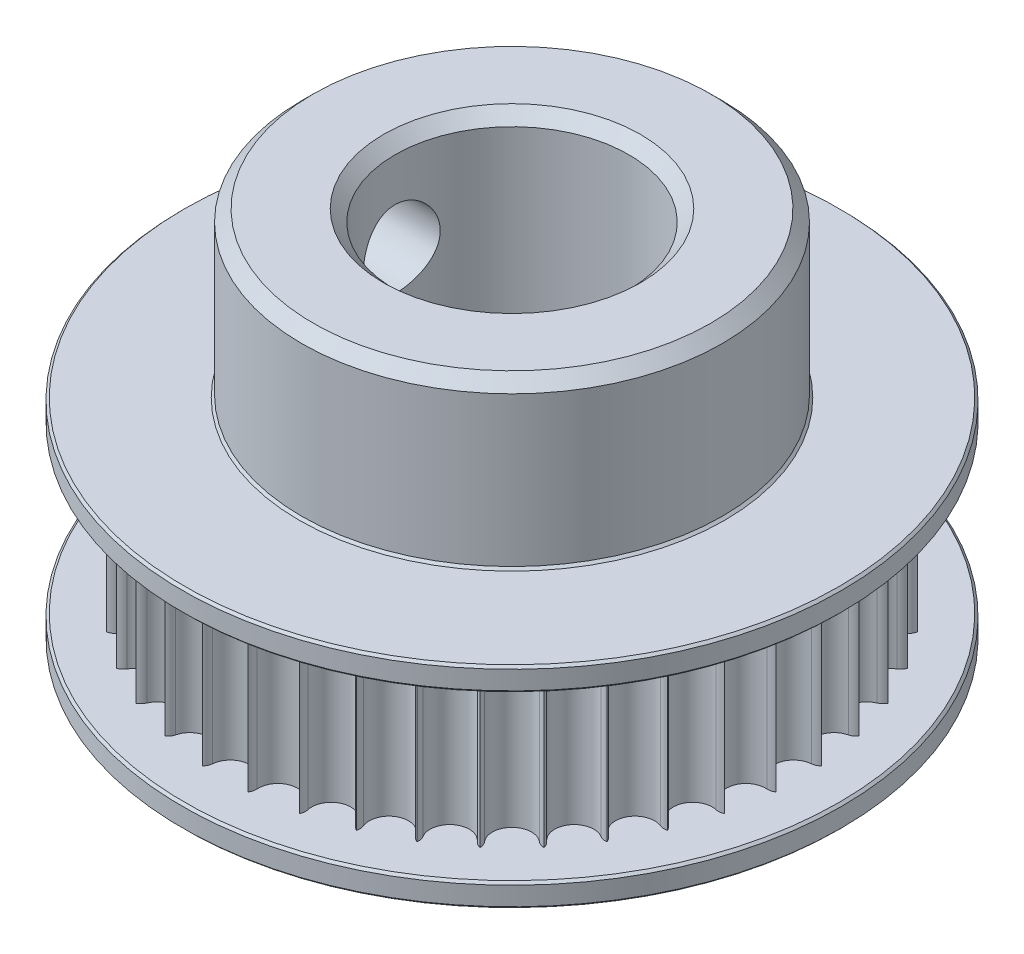
from build123d import *

# Parameters (mm, degrees)
CUT_EXTRUDE3_DEPTH      = 7
CIRPATTERN1_COUNT       = 40
CUT_EXTRUDE2_REACH      = 23.676
CUT_EXTRUDE2_END_RADIUS = 9
SKETCH3_R               = 1.65
CHAMFER1_SIZE           = 1
CHAMFER2_SIZE           = 0.5
CHAMFER3_SIZE           = 0.1


with BuildPart() as part:
    # Skica2 → Revolute (revolve)
    with BuildSketch(Plane.XY):
        Polygon((9, 8.5), (5, 8.5), (5, -8.5), (6.11, -8.5), (6.11, -7.5), (14.1, -7.5), (14.1, -6.5), (12.5, -6.5), (12.5, 0.5), (14.1, 0.5), (14.1, 1.5), (9, 1.5), align=None)
    revolve(axis=Axis((0, -8.5, 0), (0, 1, 0)))

    # Sketch2 → Cut-Extrude3 (cut)
    with BuildSketch(Plane.XZ.offset(-0.5)):
        with BuildLine():
            ThreePointArc((-0.832572418, 11.97108279), (0, 11.210469025), (0.832572418, 11.97108279))
            ThreePointArc((0.832572418, 11.97108279), (1.014312712, 12.313309772), (1.385975582, 12.422925247))
            ThreePointArc((1.385975582, 12.422925247), (1.771675151, 12.373809727), (2.155660572, 12.312722181))
            ThreePointArc((2.155660572, 12.312722181), (1.541189214, 13.740623371), (0, 13.943632401))
            ThreePointArc((0, 13.943632401), (-1.541189214, 13.740623371), (-2.155660572, 12.312722181))
            ThreePointArc((-2.155660572, 12.312722181), (-1.771675151, 12.373809727), (-1.385975582, 12.422925247))
            ThreePointArc((-1.385975582, 12.422925247), (-1.014312712, 12.313309772), (-0.832572418, 11.97108279))
        make_face()
    cut_extrude3 = extrude(amount=CUT_EXTRUDE3_DEPTH, mode=Mode.SUBTRACT)

    # CirPattern1: Cut-Extrude3 ×40 about axis
    cirpattern1_axis = Axis((0, 0, 0), (0, 1, 0))
    for i in range(1, CIRPATTERN1_COUNT):
        add(cut_extrude3.rotate(cirpattern1_axis, i * 360 / CIRPATTERN1_COUNT), mode=Mode.SUBTRACT)

    # Cut-Extrude2: up to this cylinder (the profile starts inside it)
    cut_extrude2_end = Plane(origin=(0, 4.5, 0), z_dir=(0, -1, 0)) * Cylinder(CUT_EXTRUDE2_END_RADIUS, 66.352, mode=Mode.PRIVATE)
    # Sketch3 → Cut-Extrude2 (cut, up to the surface)
    with BuildSketch(Plane(origin=(0, 0, 0), x_dir=(0, 0, -1), z_dir=(1, 0, 0)), mode=Mode.PRIVATE) as cut_extrude2_sk1:
        with Locations((0, 4.5)):
            Circle(SKETCH3_R)
    cut_extrude2_tool1 = extrude(cut_extrude2_sk1.sketch, amount=-CUT_EXTRUDE2_REACH, mode=Mode.PRIVATE) & cut_extrude2_end
    add(cut_extrude2_tool1.solids().sort_by_distance((0, 4.5, 0))[0], mode=Mode.SUBTRACT)

    # Chamfer1
    chamfer1_edges = [part.edges().sort_by_distance(p)[0] for p in [
        (-6.11, -7.5, 0),
    ]]
    chamfer(chamfer1_edges, length=CHAMFER1_SIZE - 0.0001)  # a hair under: the kernel refuses the full size

    # Chamfer2
    chamfer2_edges = [part.edges().sort_by_distance(p)[0] for p in [
        (-5, 8.5, 0),
        (-9, 8.5, 0),
    ]]
    chamfer(chamfer2_edges, length=CHAMFER2_SIZE)

    # Chamfer3
    chamfer3_edges = [part.edges().sort_by_distance(p)[0] for p in [
        (-14.1, 0.5, 0),
        (-14.1, -6.5, 0),
        (-14.1, -7.5, 0),
        (-9, 1.5, 0),
        (-14.1, 1.5, 0),
    ]]
    chamfer(chamfer3_edges, length=CHAMFER3_SIZE)


solid = part.part
